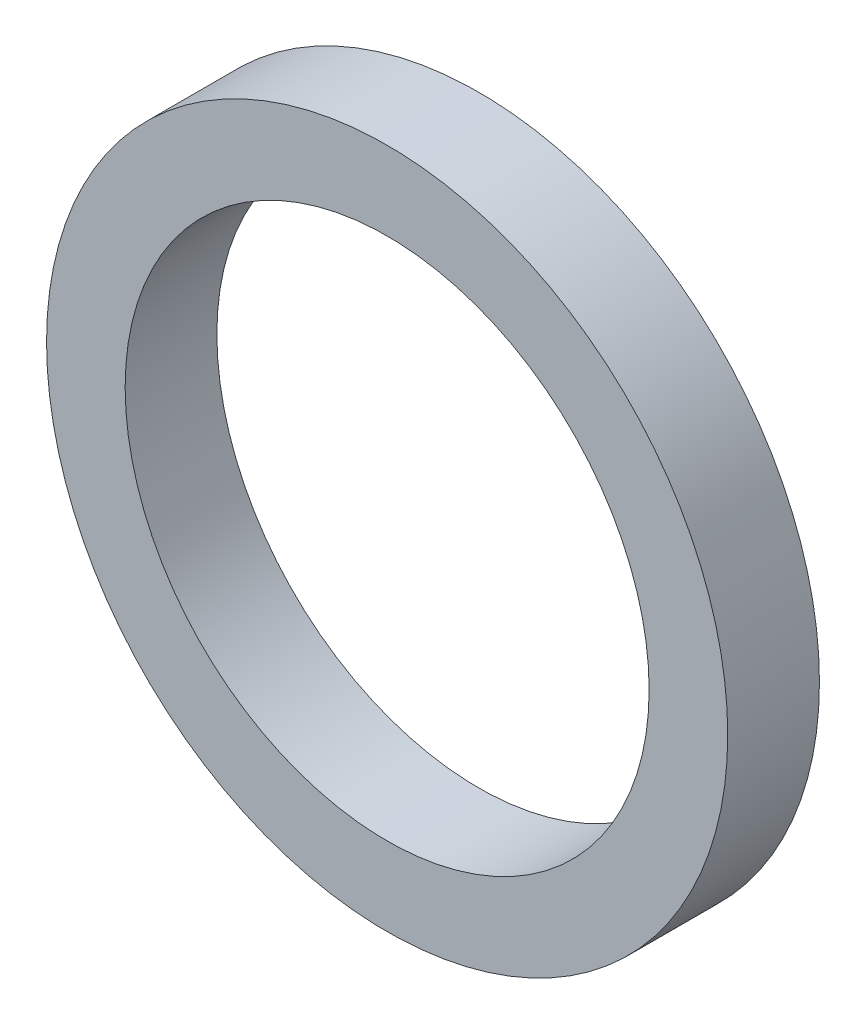
from build123d import *

# Parameters (mm, degrees)
SKETCH1_R           = 13
SKETCH1_R_2         = 10
BOSS_EXTRUDE1_DEPTH = 3.5


with BuildPart() as part:
    # Sketch1 → Boss-Extrude1 (new body)
    with BuildSketch(Plane.XY):
        Circle(SKETCH1_R)
        Circle(SKETCH1_R_2, mode=Mode.SUBTRACT)
    extrude(amount=BOSS_EXTRUDE1_DEPTH)


solid = part.part
